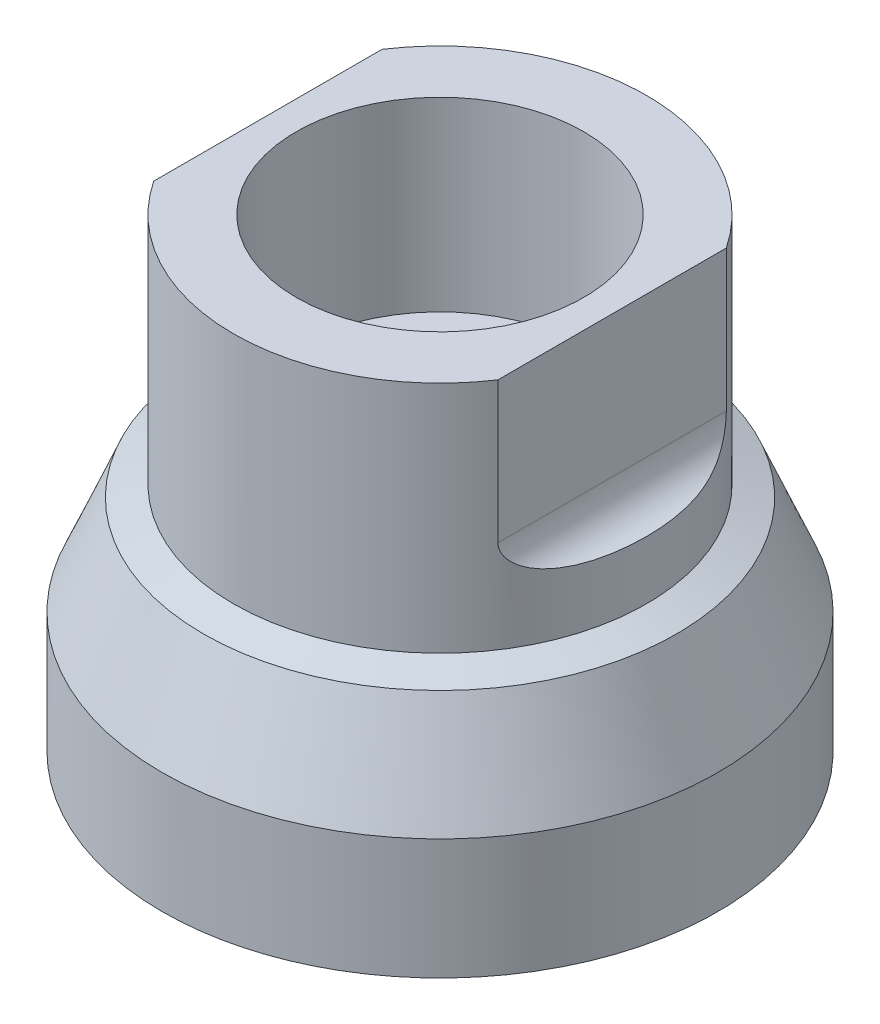
from build123d import *

# Parameters (mm, degrees)
CIRPATTERN1_COUNT       = 3
SKETCH13_R              = 10.6045
CUT_EXTRUDE1_DEPTH      = 13.716
CUT_EXTRUDE4_DEPTH      = 36.716886893
CUT_EXTRUDE4_DEPTH_BACK = 36.716886893
SKETCH17_W              = 2.54
SKETCH17_H              = 12.954
FILLET1_R               = 2.54


with BuildPart() as part:
    # Sketch1 → Revolve1 (revolve)
    with BuildSketch(Plane(origin=(0, 0, 0), x_dir=(0, 0, -1), z_dir=(1, 0, 0))):
        Polygon((0, 17.2593), (-15.24, 17.2593), (-15.24, 0), (-17.4625, -0.808923846), (-20.5105, -8.1407), (-20.5105, -17.0307), (-8.784525723, -20.8407), (0, -20.8407), align=None)
    revolve(axis=Axis((0, 17.2593, 0), (0, -1, 0)))

    # Sketch4 → Cut-Revolve2 (revolve, cut)
    with BuildSketch(Plane(origin=(-5.871974582, 1.907920197, 0), x_dir=(0, 0, -1), z_dir=(0.9510565162951535, -0.3090169943749475, 0)), mode=Mode.PRIVATE) as cut_revolve2_sk:
        Polygon((0, -4.755251275), (-6.8326, -8.388209138), (-6.8326, -25.075251275), (0, -25.075251275), align=None)
    cut_revolve2 = revolve(cut_revolve2_sk.sketch.rotate(Axis((-13.620653364, -21.940060926, 0), (0.3090169943749475, 0.9510565162951535, 0)), 90), axis=Axis((-13.620653364, -21.940060926, 0), (0.3090169943749475, 0.9510565162951535, 0)), mode=Mode.SUBTRACT)

    # Sketch10 → Cut-Revolve4 (revolve, cut)
    with BuildSketch(Plane.XY, mode=Mode.PRIVATE) as cut_revolve4_sk:
        Polygon((-20.5105, -17.0307), (-16.663911615, -15.070765324), (-11.892423344, -16.621115844), (-12.835750198, -19.524377374), (-13.779077053, -22.427638905), (-24.357088385, -18.990634676), align=None)
    cut_revolve4 = revolve(cut_revolve4_sk.sketch.rotate(Axis((-13.779077053, -22.427638905, 0), (0.3090169943749473, 0.9510565162951536, 0)), 180), axis=Axis((-13.779077053, -22.427638905, 0), (0.3090169943749473, 0.9510565162951536, 0)), mode=Mode.SUBTRACT)

    # CirPattern1: Cut-Revolve2, Cut-Revolve4 ×3 about axis
    cirpattern1_axis = Axis((0, -0.808923846, 0), (0, -1, 0))
    add([cut_revolve2.rotate(cirpattern1_axis, i * 360 / CIRPATTERN1_COUNT) for i in range(1, CIRPATTERN1_COUNT)], mode=Mode.SUBTRACT)
    add([cut_revolve4.rotate(cirpattern1_axis, i * 360 / CIRPATTERN1_COUNT) for i in range(1, CIRPATTERN1_COUNT)], mode=Mode.SUBTRACT)

    # Sketch2 → Cut-Revolve1 (revolve, cut)
    with BuildSketch(Plane.XY):
        Polygon((0, -10.6807), (-7.8994, -6.480514516), (-7.8994, 17.2593), (0, 17.2593), align=None)
    revolve(axis=Axis((0, 17.2593, 0), (0, -1, 0)), mode=Mode.SUBTRACT)

    # Sketch13 → Cut-Extrude1 (cut)
    with BuildSketch(Plane(origin=(0, 17.2593, 0), x_dir=(1, 0, 0), z_dir=(0, 1, 0))):
        with Locations(Location((0, 0, 0), (0, 0, 270))):
            Circle(SKETCH13_R)
    extrude(amount=-CUT_EXTRUDE1_DEPTH, mode=Mode.SUBTRACT)

    # Sketch17 → Cut-Extrude4 (cut, two sides: drawn at the far end of the back side and taken through both)
    with BuildSketch(Plane.XY.offset(-CUT_EXTRUDE4_DEPTH_BACK)):
        with Locations((-13.97, 10.7823)):
            Rectangle(SKETCH17_W, SKETCH17_H)
        with Locations((13.97, 10.7823)):
            Rectangle(SKETCH17_W, SKETCH17_H)
    extrude(amount=CUT_EXTRUDE4_DEPTH + CUT_EXTRUDE4_DEPTH_BACK, mode=Mode.SUBTRACT)

    # Fillet1
    fillet1_edges = [part.edges().sort_by_distance(p)[0] for p in [
        (12.7, 4.3053, 0),
        (-12.7, 4.3053, 0),
    ]]
    fillet(fillet1_edges, radius=FILLET1_R - 0.0001)  # a hair under: the kernel refuses the full size


solid = part.part
